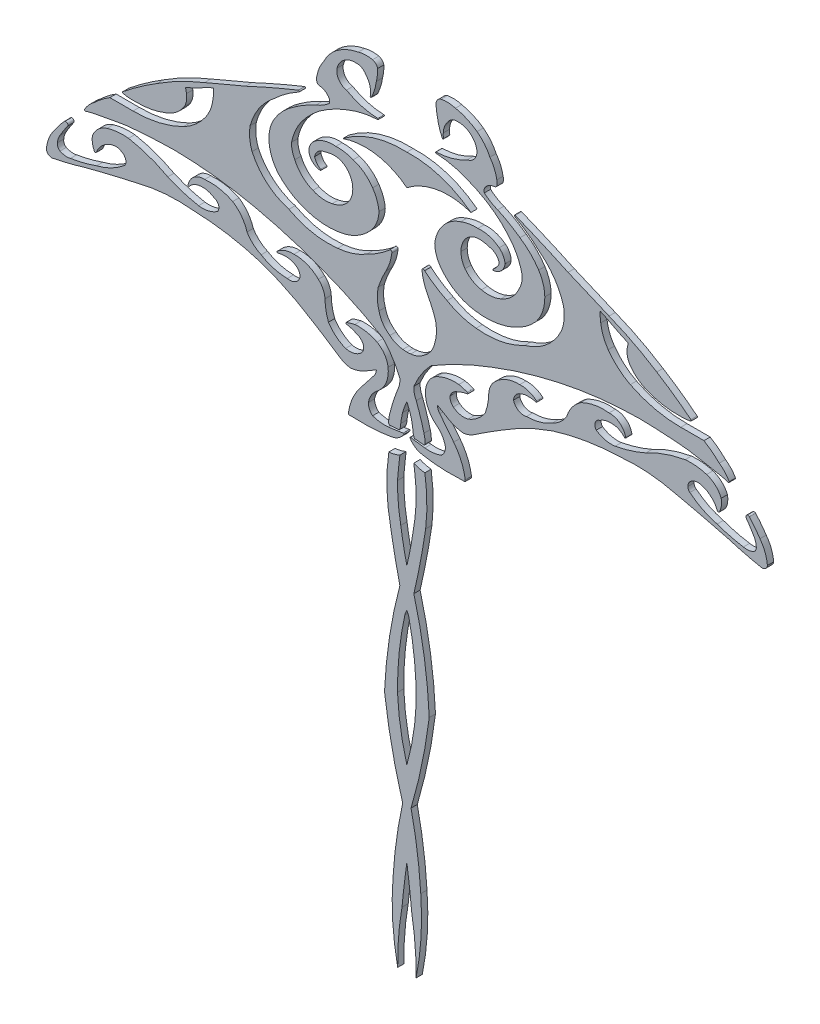
from build123d import *

# Parameters (mm, degrees)
BOSS_EXTRUDE1_DEPTH   = 10
BOSS_EXTRUDE1_2_DEPTH = 10
BOSS_EXTRUDE1_3_DEPTH = 10
BOSS_EXTRUDE1_4_DEPTH = 10
BOSS_EXTRUDE1_5_DEPTH = 10
BOSS_EXTRUDE1_6_DEPTH = 10
BOSS_EXTRUDE1_7_DEPTH = 10


with BuildPart() as part:
    # Sketch1 → Boss-Extrude1 (new body)
    with BuildSketch(Plane.XY):
        with BuildLine():
            ThreePointArc((-102.318947229, 16.81848173), (-49.002946032, 21.528952586), (0, 0))
            ThreePointArc((0, 0), (49.002946032, 21.528952586), (102.318947229, 16.81848173))
            ThreePointArc((102.318947229, 16.81848173), (54.026057792, 42.074848334), (0, 49.235316454))
            ThreePointArc((0, 49.235316454), (-54.026057792, 42.074848334), (-102.318947229, 16.81848173))
        make_face()
    extrude(amount=BOSS_EXTRUDE1_DEPTH)


with BuildPart() as body_2:
    # Sketch1 → Boss-Extrude1 2 (new body)
    with BuildSketch(Plane.XY):
        with BuildLine():
            ThreePointArc((-46.221062978, 70.934928424), (-45.669375753, 71.889460725), (-46.483035821, 72.633401584))
            ThreePointArc((-46.483035821, 72.633401584), (-72.393272929, 76.67274329), (-96.562294411, 86.846978838))
            ThreePointArc((-96.562294411, 86.846978838), (-108.801126903, 95.172800269), (-111.438890001, 109.738188321))
            ThreePointArc((-111.438890001, 109.738188321), (-100.751513842, 125.99067457), (-82.243503136, 131.975393294))
            ThreePointArc((-82.243503136, 131.975393294), (-72.322804388, 130.200988092), (-65.238460541, 123.032944444))
            ThreePointArc((-65.238460541, 123.032944444), (-60.11222754, 114.632866707), (-58.180375493, 104.983642986))
            ThreePointArc((-58.180375493, 104.983642986), (-58.056109868, 101.08465486), (-58.568228036, 97.217448461))
            ThreePointArc((-58.568228036, 97.217448461), (-57.50538541, 96.154605835), (-56.442542784, 97.217448461))
            ThreePointArc((-56.442542784, 97.217448461), (-51.619383458, 109.593156045), (-48.769127095, 122.566091055))
            ThreePointArc((-48.769127095, 122.566091055), (-47.118529182, 131.935968296), (-46.776737082, 141.443978138))
            ThreePointArc((-46.776737082, 141.443978138), (-49.609061031, 146.691441182), (-54.705374469, 149.787489744))
            ThreePointArc((-54.705374469, 149.787489744), (-66.21629068, 150.635919637), (-77.613218291, 148.810798728))
            ThreePointArc((-77.613218291, 148.810798728), (-95.719619904, 143.16410152), (-112.119316154, 133.636408639))
            ThreePointArc((-112.119316154, 133.636408639), (-123.96161548, 122.329158561), (-132.666618079, 108.461322126))
            ThreePointArc((-132.666618079, 108.461322126), (-139.671195261, 96.196737429), (-143.721126508, 82.665950454))
            ThreePointArc((-143.721126508, 82.665950454), (-144.222734024, 77.95678515), (-143.374242874, 73.297610253))
            ThreePointArc((-143.374242874, 73.297610253), (-140.426070281, 71.570738406), (-137.047963657, 71.05868016))
            ThreePointArc((-137.047963657, 71.05868016), (-131.125682659, 68.683642329), (-126.274829211, 64.538351298))
            ThreePointArc((-126.274829211, 64.538351298), (-123.588476298, 59.993523493), (-123.755600472, 54.71678006))
            ThreePointArc((-123.755600472, 54.71678006), (-133.791887223, 47.333367563), (-145.029441214, 41.951991148))
            ThreePointArc((-145.029441214, 41.951991148), (-163.371744028, 32.411399599), (-180.688527947, 21.115738736))
            ThreePointArc((-180.688527947, 21.115738736), (-197.146174846, 7.731654463), (-210.510022231, -8.742429315))
            ThreePointArc((-210.510022231, -8.742429315), (-217.685950852, -24.079327442), (-220.321932176, -40.80553437))
            ThreePointArc((-220.321932176, -40.80553437), (-216.812884772, -62.827113684), (-206.017349228, -82.339155646))
            ThreePointArc((-206.017349228, -82.339155646), (-189.970951569, -96.755863851), (-171.19080916, -107.368808986))
            ThreePointArc((-171.19080916, -107.368808986), (-140.6105083, -116.031728879), (-108.829891428, -115.59198695))
            ThreePointArc((-108.829891428, -115.59198695), (-80.427625373, -106.254458177), (-57.278841738, -87.333253754))
            ThreePointArc((-57.278841738, -87.333253754), (-48.124899027, -72.454928903), (-44.493385634, -55.367760384))
            ThreePointArc((-44.493385634, -55.367760384), (-47.817186866, -40.838564323), (-54.705374469, -27.621224789))
            ThreePointArc((-54.705374469, -27.621224789), (-68.206050126, -13.221832007), (-85.761805178, -4.19929244))
            ThreePointArc((-85.761805178, -4.19929244), (-99.35400115, -0.366238776), (-113.448366435, 0.521994848))
            ThreePointArc((-113.448366435, 0.521994848), (-131.392405228, -1.139550227), (-147.437222108, -9.344007038))
            ThreePointArc((-147.437222108, -9.344007038), (-153.962706572, -17.16583418), (-156.679644791, -26.983225587))
            ThreePointArc((-156.679644791, -26.983225587), (-154.2574666, -34.862472726), (-148.888527768, -41.117389072))
            ThreePointArc((-148.888527768, -41.117389072), (-144.12845236, -44.072094965), (-138.641830825, -45.205933108))
            ThreePointArc((-138.641830825, -45.205933108), (-137.403310923, -44.622536515), (-137.986707515, -43.384016613))
            ThreePointArc((-137.986707515, -43.384016613), (-143.817669949, -37.905922136), (-147.437222108, -30.770903972))
            ThreePointArc((-147.437222108, -30.770903972), (-142.048471626, -20.977234964), (-131.99581445, -16.088608561))
            ThreePointArc((-131.99581445, -16.088608561), (-123.859643334, -14.065315744), (-115.518208838, -13.221832007))
            ThreePointArc((-115.518208838, -13.221832007), (-104.590903803, -15.606108425), (-95.368451847, -21.933599974))
            ThreePointArc((-95.368451847, -21.933599974), (-88.673634843, -32.615420552), (-86.406942987, -45.016387191))
            ThreePointArc((-86.406942987, -45.016387191), (-87.971200479, -55.801162967), (-92.756351581, -65.592006596))
            ThreePointArc((-92.756351581, -65.592006596), (-104.40544944, -76.125350799), (-119.117522211, -81.621507255))
            ThreePointArc((-119.117522211, -81.621507255), (-134.853600995, -82.695136211), (-150.114708119, -78.710733619))
            ThreePointArc((-150.114708119, -78.710733619), (-167.313057473, -67.558729716), (-179.048513432, -50.753091228))
            ThreePointArc((-179.048513432, -50.753091228), (-183.143581354, -40.337125591), (-184.264868996, -29.201388729))
            ThreePointArc((-184.264868996, -29.201388729), (-178.3221419, -10.565121483), (-168.806450898, 6.525170701))
            ThreePointArc((-168.806450898, 6.525170701), (-155.350348441, 22.280111738), (-139.846741598, 36.025039357))
            ThreePointArc((-139.846741598, 36.025039357), (-118.879005679, 49.319267057), (-96.294335519, 59.630189102))
            ThreePointArc((-96.294335519, 59.630189102), (-71.897647118, 67.525305357), (-46.485848041, 70.956301316))
            ThreePointArc((-46.485848041, 70.956301316), (-46.353886103, 70.940280322), (-46.221062978, 70.934928424))
        make_face()
    extrude(amount=BOSS_EXTRUDE1_2_DEPTH)


with BuildPart() as body_3:
    # Sketch1 → Boss-Extrude1 3 (new body)
    with BuildSketch(Plane.XY):
        with BuildLine():
            ThreePointArc((-24.093993941, -102.423086107), (-25.341515497, -99.40124595), (-28.363355653, -100.648767507))
            ThreePointArc((-28.363355653, -100.648767507), (-45.500919239, -113.434380373), (-64.095642782, -123.989200995))
            ThreePointArc((-64.095642782, -123.989200995), (-86.485212711, -134.145545325), (-110.576674028, -139.049183096))
            ThreePointArc((-110.576674028, -139.049183096), (-150.698553755, -137.568095255), (-188.48178396, -123.989200995))
            ThreePointArc((-188.48178396, -123.989200995), (-223.453671213, -105.286912897), (-247.311480737, -73.607054898))
            ThreePointArc((-247.311480737, -73.607054898), (-251.088998235, -56.69494282), (-250.409049494, -39.379434074))
            ThreePointArc((-250.409049494, -39.379434074), (-236.088892193, -8.207672427), (-212.627493313, 16.81848173))
            ThreePointArc((-212.627493313, 16.81848173), (-193.342041027, 32.890056469), (-172.124740178, 46.30833986))
            ThreePointArc((-172.124740178, 46.30833986), (-171.664736483, 47.867492185), (-173.223888808, 48.32749588))
            ThreePointArc((-173.223888808, 48.32749588), (-215.624238589, 30.602113072), (-257.509460174, 11.691611492))
            ThreePointArc((-257.509460174, 11.691611492), (-290.268255149, -2.128413659), (-322.967560011, -16.088614406))
            ThreePointArc((-322.967560011, -16.088614406), (-361.996695628, -33.881116732), (-399.120413915, -55.367766228))
            ThreePointArc((-399.120413915, -55.367766228), (-426.957506741, -73.799450964), (-453.594212162, -93.926961082))
            ThreePointArc((-453.594212162, -93.926961082), (-454.107314536, -95.559843717), (-452.606221397, -96.382217803))
            ThreePointArc((-452.606221397, -96.382217803), (-442.899025061, -97.688873484), (-433.104306261, -97.711086545))
            ThreePointArc((-433.104306261, -97.711086545), (-408.408191816, -95.708519155), (-384.638511221, -88.714905696))
            ThreePointArc((-384.638511221, -88.714905696), (-368.127014237, -79.63158784), (-355.55615434, -65.59201244))
            ThreePointArc((-355.55615434, -65.59201244), (-352.046783152, -55.975482786), (-351.938457039, -45.73919468))
            ThreePointArc((-351.938457039, -45.73919468), (-352.606964978, -42.575962024), (-353.424008688, -39.447802297))
            ThreePointArc((-353.424008688, -39.447802297), (-353.549275488, -38.489806098), (-352.903322919, -37.771339837))
            ThreePointArc((-352.903322919, -37.771339837), (-341.611663029, -32.656849403), (-330.511034889, -27.139997912))
            ThreePointArc((-330.511034889, -27.139997912), (-320.507090357, -21.844378125), (-310.299987776, -16.951776361))
            ThreePointArc((-310.299987776, -16.951776361), (-308.988493434, -16.934681656), (-308.638457151, -18.19871656))
            ThreePointArc((-308.638457151, -18.19871656), (-308.822193679, -25.165282172), (-309.659143594, -32.083830458))
            ThreePointArc((-309.659143594, -32.083830458), (-313.661110181, -48.418340791), (-321.596335541, -63.246157988))
            ThreePointArc((-321.596335541, -63.246157988), (-337.39109934, -80.696204158), (-356.847157557, -93.941598581))
            ThreePointArc((-356.847157557, -93.941598581), (-396.040336041, -108.07035922), (-437.453312491, -112.619260016))
            ThreePointArc((-437.453312491, -112.619260016), (-455.959093862, -112.536174615), (-474.464889931, -112.615918824))
            ThreePointArc((-474.464889931, -112.615918824), (-487.253858531, -121.431229958), (-498.976660496, -131.621585315))
            ThreePointArc((-498.976660496, -131.621585315), (-507.966666564, -139.465841601), (-514.928059295, -149.155608215))
            ThreePointArc((-514.928059295, -149.155608215), (-514.725461673, -150.316427031), (-513.761380664, -150.993991735))
            ThreePointArc((-513.761380664, -150.993991735), (-506.447154128, -148.853617628), (-499.013022291, -147.176478704))
            ThreePointArc((-499.013022291, -147.176478704), (-473.513623941, -142.407875263), (-447.962298571, -137.925837017))
            ThreePointArc((-447.962298571, -137.925837017), (-409.854873263, -134.977864536), (-371.659664916, -133.56631762))
            ThreePointArc((-371.659664916, -133.56631762), (-307.015264004, -137.607600422), (-243.109639157, -148.157560084))
            ThreePointArc((-243.109639157, -148.157560084), (-189.21636217, -162.083590275), (-136.560142719, -180.131919127))
            ThreePointArc((-136.560142719, -180.131919127), (-86.533411626, -201.25747084), (-38.611563672, -226.80075269))
            ThreePointArc((-38.611563672, -226.80075269), (-22.908371049, -246.662844345), (-11.156253716, -269.090075152))
            ThreePointArc((-11.156253716, -269.090075152), (-11.830550903, -278.341947301), (-14.95923313, -287.074825549))
            ThreePointArc((-14.95923313, -287.074825549), (-21.67532916, -306.342592698), (-27.310202959, -325.953839319))
            ThreePointArc((-27.310202959, -325.953839319), (-28.721361994, -333.065110627), (-28.990659723, -340.310041833))
            ThreePointArc((-28.990659723, -340.310041833), (-27.951160322, -342.055547513), (-25.921525758, -342.144612797))
            ThreePointArc((-25.921525758, -342.144612797), (-19.02532834, -341.455816758), (-12.115179241, -340.924951192))
            ThreePointArc((-12.115179241, -340.924951192), (-10.381902487, -336.121837922), (-9.7767987, -331.051532724))
            ThreePointArc((-9.7767987, -331.051532724), (-8.538324658, -322.830580531), (-6.887071252, -314.682498848))
            ThreePointArc((-6.887071252, -314.682498848), (-3.821000696, -305.264792052), (0, -296.127290006))
            ThreePointArc((0, -296.127290006), (3.821000696, -305.264792052), (6.887071252, -314.682498848))
            ThreePointArc((6.887071252, -314.682498848), (8.538324658, -322.830580531), (9.7767987, -331.051532724))
            ThreePointArc((9.7767987, -331.051532724), (10.381902487, -336.121837922), (12.115179241, -340.924951192))
            ThreePointArc((12.115179241, -340.924951192), (19.02532834, -341.455816758), (25.921525758, -342.144612797))
            ThreePointArc((25.921525758, -342.144612797), (27.951160322, -342.055547513), (28.990659723, -340.310041833))
            ThreePointArc((28.990659723, -340.310041833), (28.721361994, -333.065110627), (27.310202959, -325.953839319))
            ThreePointArc((27.310202959, -325.953839319), (21.67532916, -306.342592698), (14.95923313, -287.074825549))
            ThreePointArc((14.95923313, -287.074825549), (11.830550903, -278.341947301), (11.156253716, -269.090075152))
            ThreePointArc((11.156253716, -269.090075152), (22.908371049, -246.662844345), (38.611563672, -226.80075269))
            ThreePointArc((38.611563672, -226.80075269), (86.533411626, -201.25747084), (136.560142719, -180.131919127))
            ThreePointArc((136.560142719, -180.131919127), (189.21636217, -162.083590275), (243.109639157, -148.157560084))
            ThreePointArc((243.109639157, -148.157560084), (307.015264004, -137.607600422), (371.659664916, -133.56631762))
            ThreePointArc((371.659664916, -133.56631762), (409.854873263, -134.977864536), (447.962298571, -137.925837017))
            ThreePointArc((447.962298571, -137.925837017), (473.513623941, -142.407875263), (499.013022291, -147.176478704))
            ThreePointArc((499.013022291, -147.176478704), (506.447154128, -148.853617628), (513.761380664, -150.993991735))
            ThreePointArc((513.761380664, -150.993991735), (514.725461673, -150.316427031), (514.928059295, -149.155608215))
            ThreePointArc((514.928059295, -149.155608215), (507.966666564, -139.465841601), (498.976660496, -131.621585315))
            ThreePointArc((498.976660496, -131.621585315), (487.253858531, -121.431229958), (474.464889931, -112.615918824))
            ThreePointArc((474.464889931, -112.615918824), (455.959093862, -112.536174615), (437.453312491, -112.619260016))
            ThreePointArc((437.453312491, -112.619260016), (396.040336041, -108.07035922), (356.847157557, -93.941598581))
            ThreePointArc((356.847157557, -93.941598581), (337.39109934, -80.696204158), (321.596335541, -63.246157988))
            ThreePointArc((321.596335541, -63.246157988), (313.661110181, -48.418340791), (309.659143594, -32.083830458))
            ThreePointArc((309.659143594, -32.083830458), (308.822193679, -25.165282172), (308.638457151, -18.19871656))
            ThreePointArc((308.638457151, -18.19871656), (308.988493434, -16.934681656), (310.299987776, -16.951776361))
            ThreePointArc((310.299987776, -16.951776361), (320.507090357, -21.844378125), (330.511034889, -27.139997912))
            ThreePointArc((330.511034889, -27.139997912), (341.611663029, -32.656849403), (352.903322919, -37.771339837))
            ThreePointArc((352.903322919, -37.771339837), (353.549275488, -38.489806098), (353.424008688, -39.447802297))
            ThreePointArc((353.424008688, -39.447802297), (352.606964978, -42.575962024), (351.938457039, -45.73919468))
            ThreePointArc((351.938457039, -45.73919468), (352.046783152, -55.975482786), (355.55615434, -65.59201244))
            ThreePointArc((355.55615434, -65.59201244), (368.127014237, -79.63158784), (384.638511221, -88.714905696))
            ThreePointArc((384.638511221, -88.714905696), (408.408191816, -95.708519155), (433.104306261, -97.711086545))
            ThreePointArc((433.104306261, -97.711086545), (442.899025061, -97.688873484), (452.606221397, -96.382217803))
            ThreePointArc((452.606221397, -96.382217803), (454.107314536, -95.559843717), (453.594212162, -93.926961082))
            ThreePointArc((453.594212162, -93.926961082), (426.957506741, -73.799450964), (399.120413915, -55.367766228))
            ThreePointArc((399.120413915, -55.367766228), (361.996695628, -33.881116732), (322.967560011, -16.088614406))
            ThreePointArc((322.967560011, -16.088614406), (290.268255149, -2.128413659), (257.509460174, 11.691611492))
            ThreePointArc((257.509460174, 11.691611492), (215.624238589, 30.602113072), (173.223888808, 48.32749588))
            ThreePointArc((173.223888808, 48.32749588), (171.664736483, 47.867492185), (172.124740178, 46.30833986))
            ThreePointArc((172.124740178, 46.30833986), (193.342041027, 32.890056469), (212.627493313, 16.81848173))
            ThreePointArc((212.627493313, 16.81848173), (236.088892193, -8.207672427), (250.409049494, -39.379434074))
            ThreePointArc((250.409049494, -39.379434074), (251.088998235, -56.69494282), (247.311480737, -73.607054898))
            ThreePointArc((247.311480737, -73.607054898), (223.453671213, -105.286912897), (188.48178396, -123.989200995))
            ThreePointArc((188.48178396, -123.989200995), (150.698553755, -137.568095255), (110.576674028, -139.049183096))
            ThreePointArc((110.576674028, -139.049183096), (86.485212711, -134.145545325), (64.095642782, -123.989200995))
            ThreePointArc((64.095642782, -123.989200995), (45.500919239, -113.434380373), (28.363355653, -100.648767507))
            ThreePointArc((28.363355653, -100.648767507), (25.341515497, -99.40124595), (24.093993941, -102.423086107))
            ThreePointArc((24.093993941, -102.423086107), (27.310202959, -117.45820432), (33.293297388, -131.621585315))
            ThreePointArc((33.293297388, -131.621585315), (40.116801205, -145.722853742), (45.68937348, -160.363632883))
            ThreePointArc((45.68937348, -160.363632883), (47.172100347, -176.620035664), (44.493385634, -192.72263166))
            ThreePointArc((44.493385634, -192.72263166), (38.354976811, -207.03494627), (27.310202959, -218.013807))
            ThreePointArc((27.310202959, -218.013807), (17.52625532, -224.083237865), (6.337924988, -226.80075269))
            ThreePointArc((6.337924988, -226.80075269), (3.182192406, -227.219597703), (0, -227.307522515))
            ThreePointArc((0, -227.307522515), (-3.182192406, -227.219597703), (-6.337924988, -226.80075269))
            ThreePointArc((-6.337924988, -226.80075269), (-17.52625532, -224.083237865), (-27.310202959, -218.013807))
            ThreePointArc((-27.310202959, -218.013807), (-38.354976811, -207.03494627), (-44.493385634, -192.72263166))
            ThreePointArc((-44.493385634, -192.72263166), (-47.172100347, -176.620035664), (-45.68937348, -160.363632883))
            ThreePointArc((-45.68937348, -160.363632883), (-40.116801205, -145.722853742), (-33.293297388, -131.621585315))
            ThreePointArc((-33.293297388, -131.621585315), (-27.310202959, -117.45820432), (-24.093993941, -102.423086107))
        make_face()
    extrude(amount=BOSS_EXTRUDE1_3_DEPTH)


with BuildPart() as body_4:
    # Sketch1 → Boss-Extrude1 4 (new body)
    with BuildSketch(Plane.XY):
        with BuildLine():
            ThreePointArc((-541.622587413, -185.400534443), (-542.834343679, -181.408697361), (-546.997860423, -181.669934518))
            ThreePointArc((-546.997860423, -181.669934518), (-555.903131954, -192.299256352), (-564.00866555, -203.550330471))
            ThreePointArc((-564.00866555, -203.550330471), (-572.180132814, -218.252624607), (-575.884028164, -234.660290175))
            ThreePointArc((-575.884028164, -234.660290175), (-572.696927061, -240.364524984), (-566.438483545, -242.242766974))
            ThreePointArc((-566.438483545, -242.242766974), (-539.39255139, -236.164491139), (-512.69598179, -228.699837437))
            ThreePointArc((-512.69598179, -228.699837437), (-470.708602462, -218.207027046), (-428.520636314, -208.552255948))
            ThreePointArc((-428.520636314, -208.552255948), (-384.82761018, -201.452193747), (-340.565551493, -202.053506365))
            ThreePointArc((-340.565551493, -202.053506365), (-286.056313173, -207.387833457), (-232.772397154, -220.058129484))
            ThreePointArc((-232.772397154, -220.058129484), (-190.700310408, -237.539428036), (-151.009230538, -259.906244103))
            ThreePointArc((-151.009230538, -259.906244103), (-129.199623892, -273.547559436), (-107.728908384, -287.71628562))
            ThreePointArc((-107.728908384, -287.71628562), (-99.438430632, -292.050638475), (-90.383915556, -294.403167486))
            ThreePointArc((-90.383915556, -294.403167486), (-78.747349046, -292.127860058), (-67.801021839, -287.571038281))
            ThreePointArc((-67.801021839, -287.571038281), (-58.313402696, -281.931632022), (-48.769127095, -276.38865239))
            ThreePointArc((-48.769127095, -276.38865239), (-49.888325006, -281.635182724), (-52.591013292, -286.269204794))
            ThreePointArc((-52.591013292, -286.269204794), (-63.667924871, -300.423033519), (-74.769676296, -314.557387167))
            ThreePointArc((-74.769676296, -314.557387167), (-86.836548409, -334.838255352), (-93.286099944, -357.539054941))
            ThreePointArc((-93.286099944, -357.539054941), (-93.125371675, -358.992689726), (-92.756241234, -360.407832963))
            ThreePointArc((-92.756241234, -360.407832963), (-87.332642219, -360.429852185), (-81.909043205, -360.407832963))
            ThreePointArc((-81.909043205, -360.407832963), (-53.238603495, -360.380146048), (-24.783621666, -356.871743442))
            ThreePointArc((-24.783621666, -356.871743442), (-13.675395447, -352.694976646), (-5.324801998, -344.262559456))
            ThreePointArc((-5.324801998, -344.262559456), (-4.850847244, -343.052149786), (-5.94402205, -342.348805262))
            ThreePointArc((-5.94402205, -342.348805262), (-17.351689059, -344.099705081), (-28.793454359, -345.611830598))
            ThreePointArc((-28.793454359, -345.611830598), (-41.910298252, -345.698428966), (-54.705264121, -342.809148535))
            ThreePointArc((-54.705264121, -342.809148535), (-59.864207171, -336.141477361), (-61.563796035, -327.884121248))
            ThreePointArc((-61.563796035, -327.884121248), (-56.709143104, -315.292404981), (-47.769406079, -305.182999678))
            ThreePointArc((-47.769406079, -305.182999678), (-33.300040224, -286.738609376), (-30.019923876, -263.526566841))
            ThreePointArc((-30.019923876, -263.526566841), (-35.736648073, -248.295235675), (-47.775963386, -237.353148516))
            ThreePointArc((-47.775963386, -237.353148516), (-64.913542902, -231.535635902), (-82.988918671, -230.62961414))
            ThreePointArc((-82.988918671, -230.62961414), (-89.788668198, -232.41204718), (-96.449234078, -234.659384118))
            ThreePointArc((-96.449234078, -234.659384118), (-97.596473551, -235.613381009), (-96.894411188, -236.929958736))
            ThreePointArc((-96.894411188, -236.929958736), (-88.267610945, -238.890822771), (-80.08021237, -242.24241564))
            ThreePointArc((-80.08021237, -242.24241564), (-73.164103024, -246.470605997), (-69.019608514, -253.437192494))
            ThreePointArc((-69.019608514, -253.437192494), (-69.856193836, -260.478155609), (-74.107286733, -266.15294598))
            ThreePointArc((-74.107286733, -266.15294598), (-85.357188272, -271.431320281), (-97.782446054, -271.245608212))
            ThreePointArc((-97.782446054, -271.245608212), (-113.33754987, -262.140421934), (-125.279508599, -248.640225877))
            ThreePointArc((-125.279508599, -248.640225877), (-129.297326315, -234.078509184), (-130.82158232, -219.049766859))
            ThreePointArc((-130.82158232, -219.049766859), (-133.890100331, -207.154929376), (-141.313532636, -197.367405974))
            ThreePointArc((-141.313532636, -197.367405974), (-159.22742287, -185.731555057), (-180.293761606, -182.194626716))
            ThreePointArc((-180.293761606, -182.194626716), (-194.554998548, -184.177309939), (-207.031418406, -191.364302313))
            ThreePointArc((-207.031418406, -191.364302313), (-207.519364005, -192.720933042), (-206.334551195, -193.542368644))
            ThreePointArc((-206.334551195, -193.542368644), (-201.658978197, -192.417170108), (-196.869029643, -191.988862455))
            ThreePointArc((-196.869029643, -191.988862455), (-188.572091373, -192.144012283), (-180.688417599, -194.734561252))
            ThreePointArc((-180.688417599, -194.734561252), (-173.426767912, -200.075157668), (-170.362076899, -208.552255948))
            ThreePointArc((-170.362076899, -208.552255948), (-178.099018532, -219.049766859), (-190.992723578, -221.001784116))
            ThreePointArc((-190.992723578, -221.001784116), (-212.714283584, -217.930679763), (-232.772397154, -209.046427906))
            ThreePointArc((-232.772397154, -209.046427906), (-245.565487504, -200.694887851), (-255.299859281, -188.919770523))
            ThreePointArc((-255.299859281, -188.919770523), (-264.03178358, -171.525814708), (-278.180860785, -158.161690526))
            ThreePointArc((-278.180860785, -158.161690526), (-299.984219866, -150.846659509), (-322.967452183, -150.029849697))
            ThreePointArc((-322.967452183, -150.029849697), (-340.020361088, -155.441234242), (-349.455213344, -170.642166704))
            ThreePointArc((-349.455213344, -170.642166704), (-348.830465757, -172.12012769), (-347.352504771, -171.495380103))
            ThreePointArc((-347.352504771, -171.495380103), (-339.136040925, -165.147072101), (-329.084529634, -162.543533473))
            ThreePointArc((-329.084529634, -162.543533473), (-318.074585631, -163.320390289), (-308.000126507, -167.829009458))
            ThreePointArc((-308.000126507, -167.829009458), (-300.775319761, -174.489397219), (-302.459833087, -184.170358561))
            ThreePointArc((-302.459833087, -184.170358561), (-316.905966592, -190.556373785), (-332.687022188, -191.212306687))
            ThreePointArc((-332.687022188, -191.212306687), (-357.727565973, -185.027179519), (-381.868500065, -175.944232183))
            ThreePointArc((-381.868500065, -175.944232183), (-412.292037498, -162.343849516), (-444.536214857, -153.925116529))
            ThreePointArc((-444.536214857, -153.925116529), (-461.849207095, -153.843248307), (-478.820117632, -157.26882829))
            ThreePointArc((-478.820117632, -157.26882829), (-492.815534589, -165.309868471), (-502.043132013, -178.553035343))
            ThreePointArc((-502.043132013, -178.553035343), (-502.334974316, -188.927998854), (-499.239047976, -198.83457646))
            ThreePointArc((-499.239047976, -198.83457646), (-497.655270236, -199.90076643), (-495.917681124, -199.10962987))
            ThreePointArc((-495.917681124, -199.10962987), (-492.026616917, -191.307886822), (-486.164592471, -184.854651614))
            ThreePointArc((-486.164592471, -184.854651614), (-478.500067766, -179.222194841), (-469.571211789, -175.944232183))
            ThreePointArc((-469.571211789, -175.944232183), (-462.528512995, -175.414903245), (-455.912894971, -177.887431013))
            ThreePointArc((-455.912894971, -177.887431013), (-450.703968974, -182.347776938), (-448.74527142, -188.919770523))
            ThreePointArc((-448.74527142, -188.919770523), (-449.559507442, -192.618062889), (-451.972515774, -195.536579209))
            ThreePointArc((-451.972515774, -195.536579209), (-472.502176176, -208.929769883), (-495.483767784, -217.455669237))
            ThreePointArc((-495.483767784, -217.455669237), (-516.208425006, -223.782558207), (-537.425826739, -228.182876915))
            ThreePointArc((-537.425826739, -228.182876915), (-545.881034305, -228.655746578), (-554.017540265, -226.308107025))
            ThreePointArc((-554.017540265, -226.308107025), (-557.540092793, -222.008453721), (-557.954557034, -216.465565103))
            ThreePointArc((-557.954557034, -216.465565103), (-556.679931477, -210.090810561), (-553.81723663, -204.254103956))
            ThreePointArc((-553.81723663, -204.254103956), (-547.970938121, -194.664953382), (-541.622587413, -185.400534443))
        make_face()
    extrude(amount=BOSS_EXTRUDE1_4_DEPTH)


with BuildPart() as body_5:
    # Sketch1 → Boss-Extrude1 5 (new body)
    with BuildSketch(Plane.XY):
        with BuildLine():
            ThreePointArc((-11.156253716, -375.360875148), (-19.756464817, -378.479610245), (-28.793454359, -379.901918086))
            ThreePointArc((-28.793454359, -379.901918086), (-31.964513145, -418.36941819), (-30.019923876, -456.918383813))
            ThreePointArc((-30.019923876, -456.918383813), (-21.608783064, -506.653093665), (-11.156253716, -555.999150082))
            ThreePointArc((-11.156253716, -555.999150082), (-27.737504723, -634.816580988), (-35.728894423, -714.961842795))
            ThreePointArc((-35.728894423, -714.961842795), (-24.086471899, -785.453096382), (-6.691637851, -854.749435267))
            ThreePointArc((-6.691637851, -854.749435267), (-16.614180772, -909.782899076), (-22.175698342, -965.426483784))
            ThreePointArc((-22.175698342, -965.426483784), (-22.636269076, -1025.906801906), (-14.630296458, -1085.856659353))
            ThreePointArc((-14.630296458, -1085.856659353), (-13.311964588, -1042.333413032), (-7.818001583, -999.138189457))
            ThreePointArc((-7.818001583, -999.138189457), (-4.296308347, -966.400620007), (0, -933.755673824))
            ThreePointArc((0, -933.755673824), (4.296308347, -966.400620007), (7.818001583, -999.138189457))
            ThreePointArc((7.818001583, -999.138189457), (13.311964588, -1042.333413032), (14.630296458, -1085.856659353))
            ThreePointArc((14.630296458, -1085.856659353), (22.636269076, -1025.906801906), (22.175698342, -965.426483784))
            ThreePointArc((22.175698342, -965.426483784), (16.614180772, -909.782899076), (6.691637851, -854.749435267))
            ThreePointArc((6.691637851, -854.749435267), (24.086471899, -785.453096382), (35.728894423, -714.961842795))
            ThreePointArc((35.728894423, -714.961842795), (27.737504723, -634.816580988), (11.156253716, -555.999150082))
            ThreePointArc((11.156253716, -555.999150082), (21.608783064, -506.653093665), (30.019923876, -456.918383813))
            ThreePointArc((30.019923876, -456.918383813), (31.964513145, -418.36941819), (28.793454359, -379.901918086))
            ThreePointArc((28.793454359, -379.901918086), (19.756464817, -378.479610245), (11.156253716, -375.360875148))
            ThreePointArc((11.156253716, -375.360875148), (13.210507231, -393.873864443), (14.939554115, -412.420053459))
            ThreePointArc((14.939554115, -412.420053459), (13.796933627, -442.262122014), (9.7767987, -471.854235024))
            ThreePointArc((9.7767987, -471.854235024), (5.465533796, -497.355365045), (0, -522.634260941))
            ThreePointArc((0, -522.634260941), (-5.465533796, -497.355365045), (-9.7767987, -471.854235024))
            ThreePointArc((-9.7767987, -471.854235024), (-13.796933627, -442.262122014), (-14.939554115, -412.420053459))
            ThreePointArc((-14.939554115, -412.420053459), (-13.210507231, -393.873864443), (-11.156253716, -375.360875148))
        make_face()
        with BuildLine():
            ThreePointArc((14.95923313, -705.61007862), (10.182088025, -752.452227582), (0, -798.423230597))
            ThreePointArc((0, -798.423230597), (-10.182088025, -752.452227582), (-14.95923313, -705.61007862))
            ThreePointArc((-14.95923313, -705.61007862), (-12.30970935, -648.749774991), (-3.212246179, -592.559470943))
            ThreePointArc((-3.212246179, -592.559470943), (-1.894235172, -588.429368311), (0, -584.529781938))
            ThreePointArc((0, -584.529781938), (1.894235172, -588.429368311), (3.212246179, -592.559470943))
            ThreePointArc((3.212246179, -592.559470943), (12.30970935, -648.749774991), (14.95923313, -705.61007862))
        make_face(mode=Mode.SUBTRACT)
    extrude(amount=BOSS_EXTRUDE1_5_DEPTH)


with BuildPart() as body_6:
    # Sketch1 → Boss-Extrude1 6 (new body)
    with BuildSketch(Plane.XY):
        with BuildLine():
            ThreePointArc((575.884028164, -234.660290175), (572.180132814, -218.252624607), (564.00866555, -203.550330471))
            ThreePointArc((564.00866555, -203.550330471), (555.903131954, -192.299256352), (546.997860423, -181.669934518))
            ThreePointArc((546.997860423, -181.669934518), (542.834343679, -181.408697361), (541.622587413, -185.400534443))
            ThreePointArc((541.622587413, -185.400534443), (547.970938121, -194.664953382), (553.81723663, -204.254103956))
            ThreePointArc((553.81723663, -204.254103956), (556.679931477, -210.090810561), (557.954557034, -216.465565103))
            ThreePointArc((557.954557034, -216.465565103), (557.540092793, -222.008453721), (554.017540265, -226.308107025))
            ThreePointArc((554.017540265, -226.308107025), (545.881034305, -228.655746578), (537.425826739, -228.182876915))
            ThreePointArc((537.425826739, -228.182876915), (516.208425006, -223.782558207), (495.483767784, -217.455669237))
            ThreePointArc((495.483767784, -217.455669237), (472.502176176, -208.929769883), (451.972515774, -195.536579209))
            ThreePointArc((451.972515774, -195.536579209), (449.559507442, -192.618062889), (448.74527142, -188.919770523))
            ThreePointArc((448.74527142, -188.919770523), (450.703968974, -182.347776938), (455.912894971, -177.887431013))
            ThreePointArc((455.912894971, -177.887431013), (462.528512995, -175.414903245), (469.571211789, -175.944232183))
            ThreePointArc((469.571211789, -175.944232183), (478.500067766, -179.222194841), (486.164592471, -184.854651614))
            ThreePointArc((486.164592471, -184.854651614), (492.026616917, -191.307886822), (495.917681124, -199.10962987))
            ThreePointArc((495.917681124, -199.10962987), (497.655270236, -199.90076643), (499.239047976, -198.83457646))
            ThreePointArc((499.239047976, -198.83457646), (502.334974316, -188.927998854), (502.043132013, -178.553035343))
            ThreePointArc((502.043132013, -178.553035343), (492.815534589, -165.309868471), (478.820117632, -157.26882829))
            ThreePointArc((478.820117632, -157.26882829), (461.849207095, -153.843248307), (444.536214857, -153.925116529))
            ThreePointArc((444.536214857, -153.925116529), (412.292037498, -162.343849516), (381.868500065, -175.944232183))
            ThreePointArc((381.868500065, -175.944232183), (357.727565973, -185.027179519), (332.687022188, -191.212306687))
            ThreePointArc((332.687022188, -191.212306687), (316.905966592, -190.556373785), (302.459833087, -184.170358561))
            ThreePointArc((302.459833087, -184.170358561), (300.775319761, -174.489397219), (308.000126507, -167.829009458))
            ThreePointArc((308.000126507, -167.829009458), (318.074585631, -163.320390289), (329.084529634, -162.543533473))
            ThreePointArc((329.084529634, -162.543533473), (339.136040925, -165.147072101), (347.352504771, -171.495380103))
            ThreePointArc((347.352504771, -171.495380103), (348.830465757, -172.12012769), (349.455213344, -170.642166704))
            ThreePointArc((349.455213344, -170.642166704), (340.020361088, -155.441234242), (322.967452183, -150.029849697))
            ThreePointArc((322.967452183, -150.029849697), (299.984219866, -150.846659509), (278.180860785, -158.161690526))
            ThreePointArc((278.180860785, -158.161690526), (264.03178358, -171.525814708), (255.299859281, -188.919770523))
            ThreePointArc((255.299859281, -188.919770523), (245.565487504, -200.694887851), (232.772397154, -209.046427906))
            ThreePointArc((232.772397154, -209.046427906), (212.714283584, -217.930679763), (190.992723578, -221.001784116))
            ThreePointArc((190.992723578, -221.001784116), (178.099018532, -219.049766859), (170.362076899, -208.552255948))
            ThreePointArc((170.362076899, -208.552255948), (173.426767912, -200.075157668), (180.688417599, -194.734561252))
            ThreePointArc((180.688417599, -194.734561252), (188.572091373, -192.144012283), (196.869029643, -191.988862455))
            ThreePointArc((196.869029643, -191.988862455), (201.658978197, -192.417170108), (206.334551195, -193.542368644))
            ThreePointArc((206.334551195, -193.542368644), (207.519364005, -192.720933042), (207.031418406, -191.364302313))
            ThreePointArc((207.031418406, -191.364302313), (194.554998548, -184.177309939), (180.293761606, -182.194626716))
            ThreePointArc((180.293761606, -182.194626716), (159.22742287, -185.731555057), (141.313532636, -197.367405974))
            ThreePointArc((141.313532636, -197.367405974), (133.890100331, -207.154929376), (130.82158232, -219.049766859))
            ThreePointArc((130.82158232, -219.049766859), (129.297326315, -234.078509184), (125.279508599, -248.640225877))
            ThreePointArc((125.279508599, -248.640225877), (113.33754987, -262.140421934), (97.782446054, -271.245608212))
            ThreePointArc((97.782446054, -271.245608212), (85.357188272, -271.431320281), (74.107286733, -266.15294598))
            ThreePointArc((74.107286733, -266.15294598), (69.856193836, -260.478155609), (69.019608514, -253.437192494))
            ThreePointArc((69.019608514, -253.437192494), (73.164103024, -246.470605997), (80.08021237, -242.24241564))
            ThreePointArc((80.08021237, -242.24241564), (88.267610945, -238.890822771), (96.894411188, -236.929958736))
            ThreePointArc((96.894411188, -236.929958736), (97.596473551, -235.613381009), (96.449234078, -234.659384118))
            ThreePointArc((96.449234078, -234.659384118), (89.788668198, -232.41204718), (82.988918671, -230.62961414))
            ThreePointArc((82.988918671, -230.62961414), (64.913542902, -231.535635902), (47.775963386, -237.353148516))
            ThreePointArc((47.775963386, -237.353148516), (35.736648073, -248.295235675), (30.019923876, -263.526566841))
            ThreePointArc((30.019923876, -263.526566841), (33.300040224, -286.738609376), (47.769406079, -305.182999678))
            ThreePointArc((47.769406079, -305.182999678), (56.709143104, -315.292404981), (61.563796035, -327.884121248))
            ThreePointArc((61.563796035, -327.884121248), (59.864207171, -336.141477361), (54.705264121, -342.809148535))
            ThreePointArc((54.705264121, -342.809148535), (41.910298252, -345.698428966), (28.793454359, -345.611830598))
            ThreePointArc((28.793454359, -345.611830598), (17.351689059, -344.099705081), (5.94402205, -342.348805262))
            ThreePointArc((5.94402205, -342.348805262), (4.850847244, -343.052149786), (5.324801998, -344.262559456))
            ThreePointArc((5.324801998, -344.262559456), (13.675395447, -352.694976646), (24.783621666, -356.871743442))
            ThreePointArc((24.783621666, -356.871743442), (53.238603495, -360.380146048), (81.909043205, -360.407832963))
            ThreePointArc((81.909043205, -360.407832963), (87.332642219, -360.429852185), (92.756241234, -360.407832963))
            ThreePointArc((92.756241234, -360.407832963), (93.125371675, -358.992689726), (93.286099944, -357.539054941))
            ThreePointArc((93.286099944, -357.539054941), (86.836548409, -334.838255352), (74.769676296, -314.557387167))
            ThreePointArc((74.769676296, -314.557387167), (63.667924871, -300.423033519), (52.591013292, -286.269204794))
            ThreePointArc((52.591013292, -286.269204794), (49.888325006, -281.635182724), (48.769127095, -276.38865239))
            ThreePointArc((48.769127095, -276.38865239), (58.313402696, -281.931632022), (67.801021839, -287.571038281))
            ThreePointArc((67.801021839, -287.571038281), (78.747349046, -292.127860058), (90.383915556, -294.403167486))
            ThreePointArc((90.383915556, -294.403167486), (99.438430632, -292.050638475), (107.728908384, -287.71628562))
            ThreePointArc((107.728908384, -287.71628562), (129.199623892, -273.547559436), (151.009230538, -259.906244103))
            ThreePointArc((151.009230538, -259.906244103), (190.700310408, -237.539428036), (232.772397154, -220.058129484))
            ThreePointArc((232.772397154, -220.058129484), (286.056313173, -207.387833457), (340.565551493, -202.053506365))
            ThreePointArc((340.565551493, -202.053506365), (384.82761018, -201.452193747), (428.520636314, -208.552255948))
            ThreePointArc((428.520636314, -208.552255948), (470.708602462, -218.207027046), (512.69598179, -228.699837437))
            ThreePointArc((512.69598179, -228.699837437), (539.39255139, -236.164491139), (566.438483545, -242.242766974))
            ThreePointArc((566.438483545, -242.242766974), (572.696927061, -240.364524984), (575.884028164, -234.660290175))
        make_face()
    extrude(amount=BOSS_EXTRUDE1_6_DEPTH)


with BuildPart() as body_7:
    # Sketch1 → Boss-Extrude1 7 (new body)
    with BuildSketch(Plane.XY):
        with BuildLine():
            ThreePointArc((96.562294411, 86.846978838), (72.393272929, 76.67274329), (46.483035821, 72.633401584))
            ThreePointArc((46.483035821, 72.633401584), (45.669375753, 71.889460725), (46.221062978, 70.934928424))
            ThreePointArc((46.221062978, 70.934928424), (46.353886103, 70.940280322), (46.485848041, 70.956301316))
            ThreePointArc((46.485848041, 70.956301316), (71.897647118, 67.525305357), (96.294335519, 59.630189102))
            ThreePointArc((96.294335519, 59.630189102), (118.879005679, 49.319267057), (139.846741598, 36.025039357))
            ThreePointArc((139.846741598, 36.025039357), (155.350348441, 22.280111738), (168.806450898, 6.525170701))
            ThreePointArc((168.806450898, 6.525170701), (178.3221419, -10.565121483), (184.264868996, -29.201388729))
            ThreePointArc((184.264868996, -29.201388729), (183.143581354, -40.337125591), (179.048513432, -50.753091228))
            ThreePointArc((179.048513432, -50.753091228), (167.313057473, -67.558729716), (150.114708119, -78.710733619))
            ThreePointArc((150.114708119, -78.710733619), (134.853600995, -82.695136211), (119.117522211, -81.621507255))
            ThreePointArc((119.117522211, -81.621507255), (104.40544944, -76.125350799), (92.756351581, -65.592006596))
            ThreePointArc((92.756351581, -65.592006596), (87.971200479, -55.801162967), (86.406942987, -45.016387191))
            ThreePointArc((86.406942987, -45.016387191), (88.673634843, -32.615420552), (95.368451847, -21.933599974))
            ThreePointArc((95.368451847, -21.933599974), (104.590903803, -15.606108425), (115.518208838, -13.221832007))
            ThreePointArc((115.518208838, -13.221832007), (123.859643334, -14.065315744), (131.99581445, -16.088608561))
            ThreePointArc((131.99581445, -16.088608561), (142.048471626, -20.977234964), (147.437222108, -30.770903972))
            ThreePointArc((147.437222108, -30.770903972), (143.817669949, -37.905922136), (137.986707515, -43.384016613))
            ThreePointArc((137.986707515, -43.384016613), (137.403310923, -44.622536515), (138.641830825, -45.205933108))
            ThreePointArc((138.641830825, -45.205933108), (144.12845236, -44.072094965), (148.888527768, -41.117389072))
            ThreePointArc((148.888527768, -41.117389072), (154.2574666, -34.862472726), (156.679644791, -26.983225587))
            ThreePointArc((156.679644791, -26.983225587), (153.962706572, -17.16583418), (147.437222108, -9.344007038))
            ThreePointArc((147.437222108, -9.344007038), (131.392405228, -1.139550227), (113.448366435, 0.521994848))
            ThreePointArc((113.448366435, 0.521994848), (99.35400115, -0.366238776), (85.761805178, -4.19929244))
            ThreePointArc((85.761805178, -4.19929244), (68.206050126, -13.221832007), (54.705374469, -27.621224789))
            ThreePointArc((54.705374469, -27.621224789), (47.817186866, -40.838564323), (44.493385634, -55.367760384))
            ThreePointArc((44.493385634, -55.367760384), (48.124899027, -72.454928903), (57.278841739, -87.333253754))
            ThreePointArc((57.278841738, -87.333253754), (80.427625373, -106.254458177), (108.829891428, -115.59198695))
            ThreePointArc((108.829891428, -115.59198695), (140.6105083, -116.031728879), (171.19080916, -107.368808986))
            ThreePointArc((171.19080916, -107.368808986), (189.970951569, -96.755863851), (206.017349228, -82.339155646))
            ThreePointArc((206.017349228, -82.339155646), (216.812884772, -62.827113684), (220.321932176, -40.80553437))
            ThreePointArc((220.321932176, -40.80553437), (217.685950852, -24.079327442), (210.510022231, -8.742429315))
            ThreePointArc((210.510022231, -8.742429315), (197.146174846, 7.731654463), (180.688527947, 21.115738736))
            ThreePointArc((180.688527947, 21.115738736), (163.371744028, 32.411399599), (145.029441214, 41.951991148))
            ThreePointArc((145.029441214, 41.951991148), (133.791887223, 47.333367563), (123.755600472, 54.71678006))
            ThreePointArc((123.755600472, 54.71678006), (123.588476298, 59.993523493), (126.274829211, 64.538351298))
            ThreePointArc((126.274829211, 64.538351298), (131.125682659, 68.683642329), (137.047963657, 71.05868016))
            ThreePointArc((137.047963657, 71.05868016), (140.426070281, 71.570738406), (143.374242874, 73.297610253))
            ThreePointArc((143.374242874, 73.297610253), (144.222734024, 77.95678515), (143.721126508, 82.665950454))
            ThreePointArc((143.721126508, 82.665950454), (139.671195261, 96.196737429), (132.666618079, 108.461322126))
            ThreePointArc((132.666618079, 108.461322126), (123.96161548, 122.329158561), (112.119316154, 133.636408639))
            ThreePointArc((112.119316154, 133.636408639), (95.719619904, 143.16410152), (77.613218291, 148.810798728))
            ThreePointArc((77.613218291, 148.810798728), (66.21629068, 150.635919637), (54.705374469, 149.787489744))
            ThreePointArc((54.705374469, 149.787489744), (49.609061031, 146.691441182), (46.776737082, 141.443978138))
            ThreePointArc((46.776737082, 141.443978138), (47.118529182, 131.935968296), (48.769127095, 122.566091055))
            ThreePointArc((48.769127095, 122.566091055), (51.619383458, 109.593156045), (56.442542784, 97.217448461))
            ThreePointArc((56.442542784, 97.217448461), (57.50538541, 96.154605835), (58.568228036, 97.217448461))
            ThreePointArc((58.568228036, 97.217448461), (58.056109868, 101.08465486), (58.180375493, 104.983642986))
            ThreePointArc((58.180375493, 104.983642986), (60.11222754, 114.632866707), (65.238460541, 123.032944444))
            ThreePointArc((65.238460541, 123.032944444), (72.322804388, 130.200988092), (82.243503136, 131.975393294))
            ThreePointArc((82.243503136, 131.975393294), (100.751513842, 125.99067457), (111.438890001, 109.738188321))
            ThreePointArc((111.438890001, 109.738188321), (108.801126903, 95.172800269), (96.562294411, 86.846978838))
        make_face()
    extrude(amount=BOSS_EXTRUDE1_7_DEPTH)


solid = Compound([part.part, body_2.part, body_3.part, body_4.part, body_5.part, body_6.part, body_7.part])
